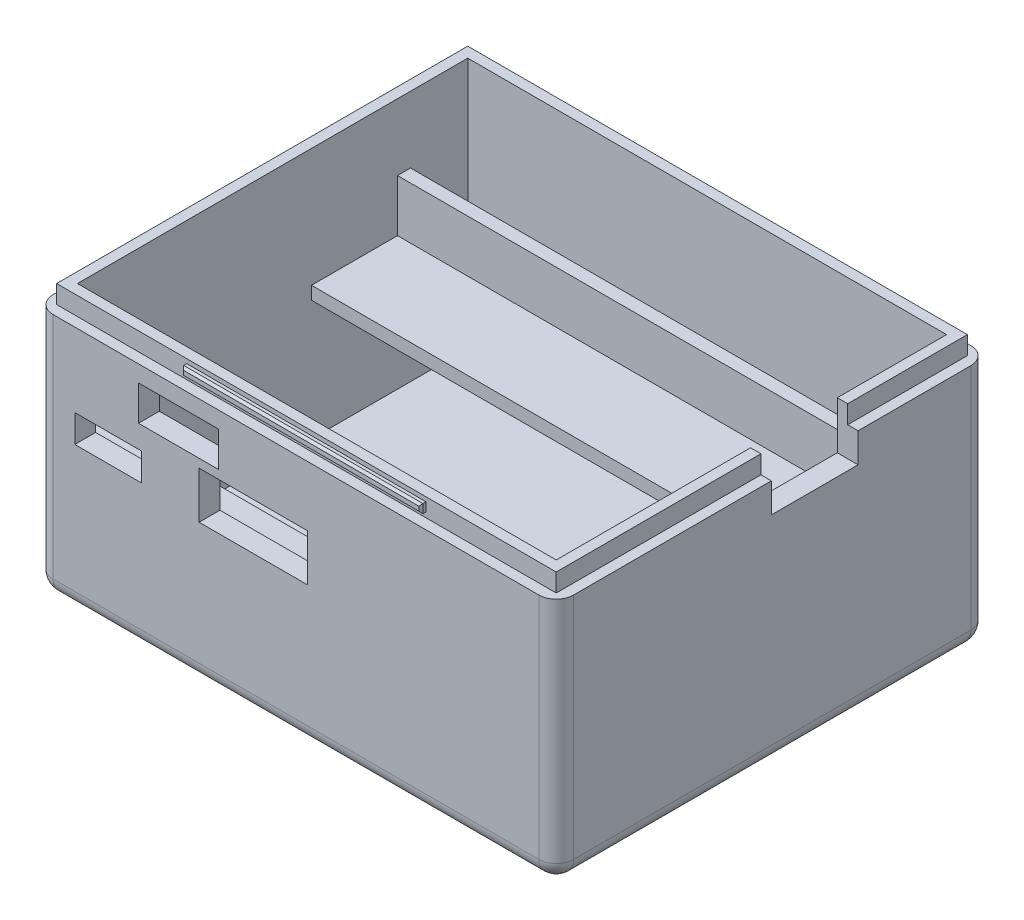
from build123d import *

# Parameters (mm, degrees)
BATTERYANDOUTERWALLS_W                  = 60
BATTERYANDOUTERWALLS_H                  = 49.8
BATTERYANDOUTERWALLS_W_2                = 55.2
BATTERYANDOUTERWALLS_H_2                = 45
WALLS_DEPTH                             = 29
SKETCH2_W                               = 60
SKETCH2_H                               = 49.8
BOTTOM_DEPTH                            = 1.5
SINKRIM_W                               = 60
SINKRIM_H                               = 49.8
SINKRIM_W_2                             = 57.6
SINKRIM_H_2                             = 47.4
TOP_CUT_DEPTH                           = 2.1
FRONTRAIL_W                             = 3
FRONTRAIL_H                             = 1.5
FRONTRAIL_W_2                           = 27.013247684
FRONTRAIL_W_3                           = 1.5
FRONTRAIL_H_2                           = 6
PCB_SUPPORTS_DEPTH                      = 60
SKETCH3_W                               = 55.2
SKETCH3_H                               = 6.6
SKETCH3_H_2                             = 9
BATTERY_INSERTION_CUT_DEPTH             = 25
USB_FRONT_W                             = 7.6828
USB_FRONT_H                             = 3.19
USB_FRONT_W_2                           = 12.5
USB_FRONT_H_2                           = 5.4
USB_FRONT_W_3                           = 9.2
USB_FRONT_H_3                           = 4.031742669
USB_FRONT_CUT_DEPTH                     = 10
USB_RIGHT_SKETCH_W                      = 10
USB_RIGHT_SKETCH_H                      = 5.5
USB_SIDE_DEPTH                          = 5
SKETCH7_W                               = 27.6
SKETCH7_H                               = 1
LID_RIDGE_FRONT_DEPTH                   = 0.6
LID_RIDGE_FRONT_CHAMFER_SIZE            = 0.25
LID_RIDGE_FRONT_CHAMFER_OF_MIRROR1_SIZE = 0.25
FILLET1_R                               = 2


with BuildPart() as part:
    # BatteryAndOuterWalls → Walls (new body)
    with BuildSketch(Plane(origin=(0, 0, 0), x_dir=(1, 0, 0), z_dir=(0, 1, 0))):
        Rectangle(BATTERYANDOUTERWALLS_W, BATTERYANDOUTERWALLS_H)
        Rectangle(BATTERYANDOUTERWALLS_W_2, BATTERYANDOUTERWALLS_H_2, mode=Mode.SUBTRACT)
    extrude(amount=WALLS_DEPTH)

    # Sketch2 → Bottom (add)
    with BuildSketch(Plane.XZ):
        Rectangle(SKETCH2_W, SKETCH2_H)
    extrude(amount=BOTTOM_DEPTH)

    # SinkRim → Top-Cut (cut)
    with BuildSketch(Plane(origin=(0, 29, 0), x_dir=(1, 0, 0), z_dir=(0, 1, 0))):
        Rectangle(SINKRIM_W, SINKRIM_H)
        Rectangle(SINKRIM_W_2, SINKRIM_H_2, mode=Mode.SUBTRACT)
    extrude(amount=-TOP_CUT_DEPTH, mode=Mode.SUBTRACT)

    # FrontRail → PCB-Supports (add)
    with BuildSketch(Plane(origin=(30, 0, 0), x_dir=(0, 0, -1), z_dir=(1, 0, 0))):
        with Locations((-21.013247684, 13.25)):
            Rectangle(FRONTRAIL_W, FRONTRAIL_H)
        with Locations((8.993376158, 14.580349305)):
            Rectangle(FRONTRAIL_W_2, FRONTRAIL_H)
        with Locations((15.15, 18.330349305)):
            Rectangle(FRONTRAIL_W_3, FRONTRAIL_H_2)
    extrude(amount=-PCB_SUPPORTS_DEPTH)

    # Sketch3 → Battery-Insertion-Cut (cut)
    with BuildSketch(Plane(origin=(0, 0, 0), x_dir=(1, 0, 0), z_dir=(0, 1, 0))):
        with Locations((0, 19.2)):
            Rectangle(SKETCH3_W, SKETCH3_H)
        with Locations((0, -0.013247684)):
            Rectangle(SKETCH3_W, SKETCH3_H_2)
    extrude(amount=BATTERY_INSERTION_CUT_DEPTH, mode=Mode.SUBTRACT)

    # USB_FRONT → USB-Front-Cut (cut)
    with BuildSketch(Plane.XY.offset(24.9)):
        with Locations((-21.660729201, 16.775056237)):
            Rectangle(USB_FRONT_W, USB_FRONT_H)
        with Locations((-4.922329201, 17.280056237)):
            Rectangle(USB_FRONT_W_2, USB_FRONT_H_2)
        with Locations((-13.562337536, 22.984128666)):
            Rectangle(USB_FRONT_W_3, USB_FRONT_H_3)
    extrude(amount=-USB_FRONT_CUT_DEPTH, mode=Mode.SUBTRACT)

    # USB-Right-Sketch → USB-Side (cut)
    with BuildSketch(Plane(origin=(30, 0, 0), x_dir=(0, 0, -1), z_dir=(1, 0, 0))):
        with Locations((4.9, 26.25)):
            Rectangle(USB_RIGHT_SKETCH_W, USB_RIGHT_SKETCH_H)
    extrude(amount=-USB_SIDE_DEPTH, mode=Mode.SUBTRACT)

    # Sketch7 → Lid-Ridge-Front (add)
    with BuildSketch(Plane.XY.offset(23.7)):
        with Locations((0, 28)):
            Rectangle(SKETCH7_W, SKETCH7_H)
    lid_ridge_front = extrude(amount=LID_RIDGE_FRONT_DEPTH)

    # Lid-Ridge-Front-Chamfer
    lid_ridge_front_chamfer_edges = [part.edges().sort_by_distance(p)[0] for p in [
        (0, 28.5, 24.3),
        (13.8, 28, 24.3),
        (0, 27.5, 24.3),
        (-13.8, 28, 24.3),
    ]]
    chamfer(lid_ridge_front_chamfer_edges, length=LID_RIDGE_FRONT_CHAMFER_SIZE)

    # Mirror1: Lid-Ridge-Front across plane
    add(lid_ridge_front.mirror(Plane.XY))

    # Lid-Ridge-Front-Chamfer of Mirror1
    lid_ridge_front_chamfer_of_mirror1_edges = [part.edges().sort_by_distance(p)[0] for p in [
        (0, 28.5, -24.3),
        (13.8, 28, -24.3),
        (0, 27.5, -24.3),
        (-13.8, 28, -24.3),
    ]]
    chamfer(lid_ridge_front_chamfer_of_mirror1_edges, length=LID_RIDGE_FRONT_CHAMFER_OF_MIRROR1_SIZE)

    # Fillet1
    fillet1_edges = [part.edges().sort_by_distance(p)[0] for p in [
        (0, -1.5, 24.9),
        (30, 12.7, 24.9),
        (-30, 12.7, 24.9),
        (-30, -1.5, 0),
        (-30, 12.7, -24.9),
        (0, -1.5, -24.9),
        (30, -1.5, 0),
        (30, 12.7, -24.9),
    ]]
    fillet(fillet1_edges, radius=FILLET1_R)


solid = part.part
